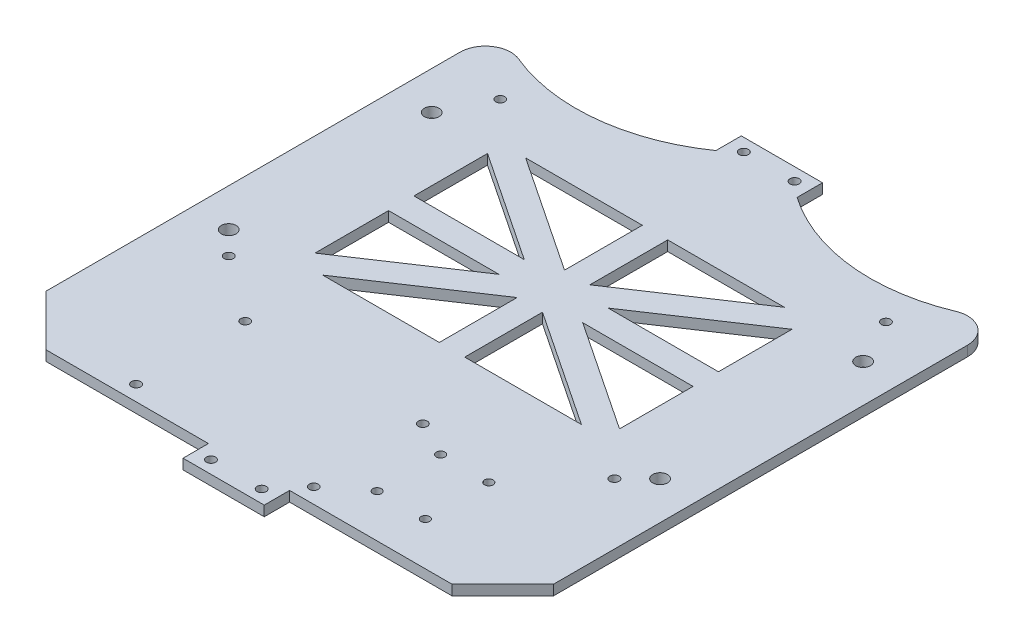
from build123d import *

# Parameters (mm, degrees)
BOSS_EXTRUDE1_DEPTH      = 4
M5_CLEARANCE_HOLE1_D     = 5.8
FILLET1_R                = 10
M3_CLEARANCE_HOLE1_D     = 3.6
M3_CLEARANCE_HOLE1_DEPTH = 10
M3_CLEARANCE_HOLE1_TIP   = 1.081549114
CHAMFER1_SIZE            = 20
M3_CLEARANCE_HOLE2_D     = 3.6
M3_CLEARANCE_HOLE3_D     = 3.4


with BuildPart() as part:
    # Sketch1 → Boss-Extrude1 (new body)
    with BuildSketch(Plane(origin=(0, 0, 0), x_dir=(1, 0, 0), z_dir=(0, 1, 0))):
        with BuildLine():
            Line((-100, -29.5), (-100, -229.5))
            Line((-100, -229.5), (-16, -229.5))
            Line((-16, -229.5), (-16, -239.5))
            Line((-16, -239.5), (16, -239.5))
            Line((16, -239.5), (16, -229.5))
            Line((16, -229.5), (100, -229.5))
            Line((100, -229.5), (100, -29.5))
            ThreePointArc((100, -29.5), (58, -42.739333694), (16, -29.5))
            Line((16, -29.5), (16, -19.5))
            Line((16, -19.5), (-16, -19.5))
            Line((-16, -19.5), (-16, -29.5))
            ThreePointArc((-16, -29.5), (-58, -42.739333694), (-100, -29.5))
        make_face()
        Polygon((-60, -143.490747874), (-60, -114.5), (-16.513878189, -114.5), align=None, mode=Mode.SUBTRACT)
        Polygon((-5, -149.5), (-50.986121811, -149.5), (-5, -118.842585459), align=None, mode=Mode.SUBTRACT)
        Polygon((50.986121811, -149.5), (5, -149.5), (5, -118.842585459), align=None, mode=Mode.SUBTRACT)
        Polygon((60, -114.5), (60, -143.490747874), (16.513878189, -114.5), align=None, mode=Mode.SUBTRACT)
        Polygon((60, -75.509252126), (60, -104.5), (16.513878189, -104.5), align=None, mode=Mode.SUBTRACT)
        Polygon((5, -69.5), (50.986121811, -69.5), (5, -100.157414541), align=None, mode=Mode.SUBTRACT)
        Polygon((-50.986121811, -69.5), (-5, -69.5), (-5, -100.157414541), align=None, mode=Mode.SUBTRACT)
        Polygon((-60, -104.5), (-60, -75.509252126), (-16.513878189, -104.5), align=None, mode=Mode.SUBTRACT)
    extrude(amount=BOSS_EXTRUDE1_DEPTH)

    # M5 Clearance Hole1 (through all)
    with Locations(Plane(origin=(0, 4, 0), x_dir=(1, 0, 0), z_dir=(0, 1, 0))):
        with Locations((-85, -72.5), (-85, -152.5), (85, -152.5), (85, -72.5)):
            Hole(M5_CLEARANCE_HOLE1_D / 2)

    # Fillet1
    fillet1_edges = [part.edges().sort_by_distance(p)[0] for p in [
        (100, 2, 29.5),
        (-100, 2, 29.5),
    ]]
    fillet(fillet1_edges, radius=FILLET1_R)

    # M3 Clearance Hole1
    with Locations(Plane(origin=(0, 4, 0), x_dir=(1, 0, 0), z_dir=(0, 1, 0))):
        with Locations((-50.5, -223.5), (-50.5, -180.5), (19.5, -180.5), (19.5, -223.5)):
            Hole(M3_CLEARANCE_HOLE1_D / 2, depth=M3_CLEARANCE_HOLE1_DEPTH)
            with Locations((0, 0, -(M3_CLEARANCE_HOLE1_DEPTH + M3_CLEARANCE_HOLE1_TIP / 2))):  # 118° drill point
                Cone(0, M3_CLEARANCE_HOLE1_D / 2, M3_CLEARANCE_HOLE1_TIP, mode=Mode.SUBTRACT)

    # Chamfer1
    chamfer1_edges = [part.edges().sort_by_distance(p)[0] for p in [
        (100, 2, 229.5),
        (-100, 2, 229.5),
    ]]
    chamfer(chamfer1_edges, length=CHAMFER1_SIZE)

    # M3 Clearance Hole2 (through all)
    with Locations(Plane(origin=(0, 4, 0), x_dir=(1, 0, 0), z_dir=(0, 1, 0))):
        with Locations((-76, -54.5), (76, -54.5), (76, -161.5), (-76, -161.5), (-10, -24.5), (10, -24.5), (-10, -234.5), (10, -234.5)):
            Hole(M3_CLEARANCE_HOLE2_D / 2)

    # M3 Clearance Hole3 (through all)
    with Locations(Plane(origin=(0, 4, 0), x_dir=(1, 0, 0), z_dir=(0, 1, 0))):
        with Locations((52.5, -187.5), (33.5, -187.5), (33.5, -212.5), (52.5, -212.5)):
            Hole(M3_CLEARANCE_HOLE3_D / 2)


solid = part.part
